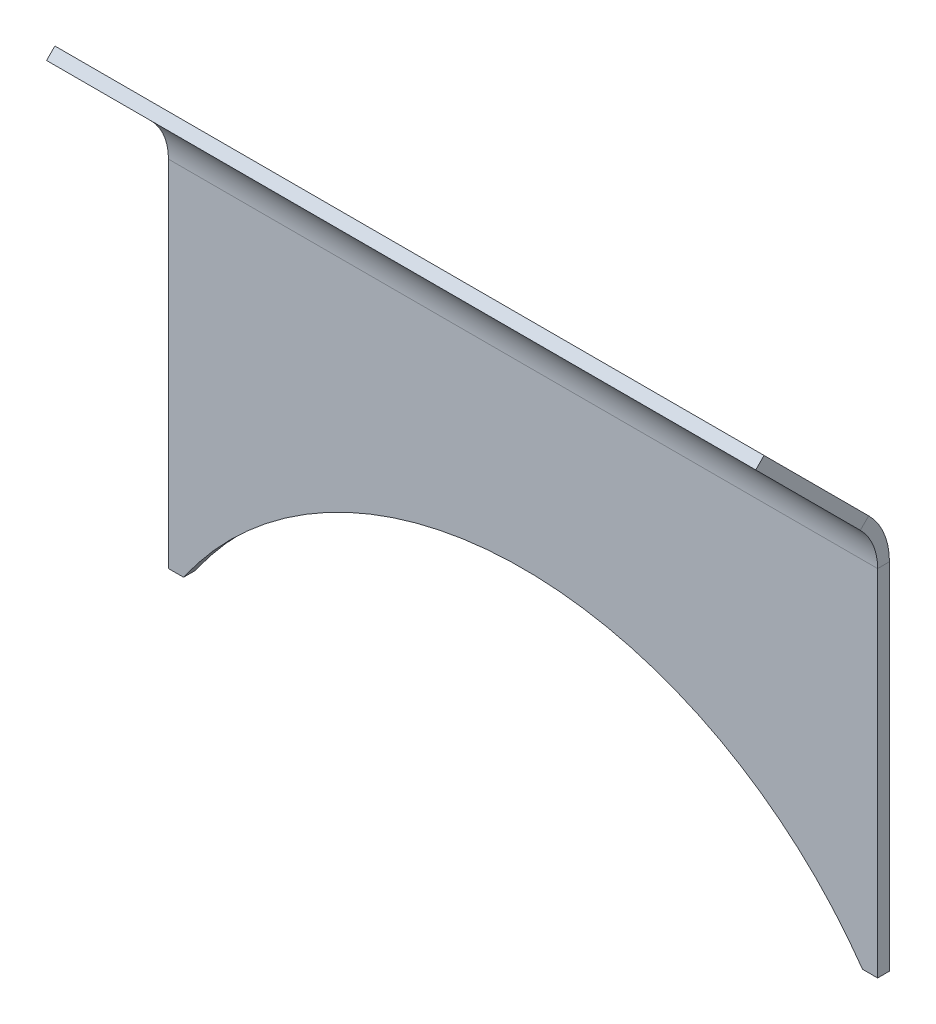
from build123d import *

# Parameters (mm, degrees)
SKETCH_2_W             = 120
SKETCH_2_H             = 60
SM_BASE_FLANGE_1_DEPTH = 2
SM_EDGE_FLANGE_1_DEPTH = 120
CUT_EXTRUDE_3_REACH    = 151.465
SKETCH_3_R             = 70


# Sheet-metal steps are written as plain solids
with BuildPart() as part:
    # Sketch 2 → Базовая кромка1 (new body)
    with BuildSketch(Plane.XY):
        with Locations((60, 30)):
            Rectangle(SKETCH_2_W, SKETCH_2_H)
    extrude(amount=SM_BASE_FLANGE_1_DEPTH)

    # Ребро-кромка1 section (across the edge) → Ребро-кромка1 (add)
    with BuildSketch(Plane(origin=(120, 64.142135624, 2), x_dir=(0, -0.7071067811865438, 0.7071067811865512), z_dir=(-1, 0, 0))):
        with BuildLine():
            Line((-2, 4.142135624), (-2, 29.171572875))
            Line((-2, 29.171572875), (0, 29.171572875))
            Line((0, 29.171572875), (0, 4.142135624))
            ThreePointArc((0, 4.142135624), (0.761204675, 0.3153013), (2.928932188, -2.928932188))
            Line((2.928932188, -2.928932188), (1.514718626, -4.343145751))
            ThreePointArc((1.514718626, -4.343145751), (-1.08655439, -0.450065565), (-2, 4.142135624))
        make_face()
    extrude(amount=SM_EDGE_FLANGE_1_DEPTH)

    # Эскиз3 → Вырез-Вытянуть3 (cut, up to next)
    with BuildSketch(Plane.XY, mode=Mode.PRIVATE) as cut_extrude_3_sk1:
        with Locations((60, -40)):
            Circle(SKETCH_3_R)
    cut_extrude_3_tool1 = extrude(cut_extrude_3_sk1.sketch, amount=CUT_EXTRUDE_3_REACH, mode=Mode.PRIVATE) & part.part
    add(cut_extrude_3_tool1.solids().sort_by_distance((60, -40, 0))[0], mode=Mode.SUBTRACT)


solid = part.part
